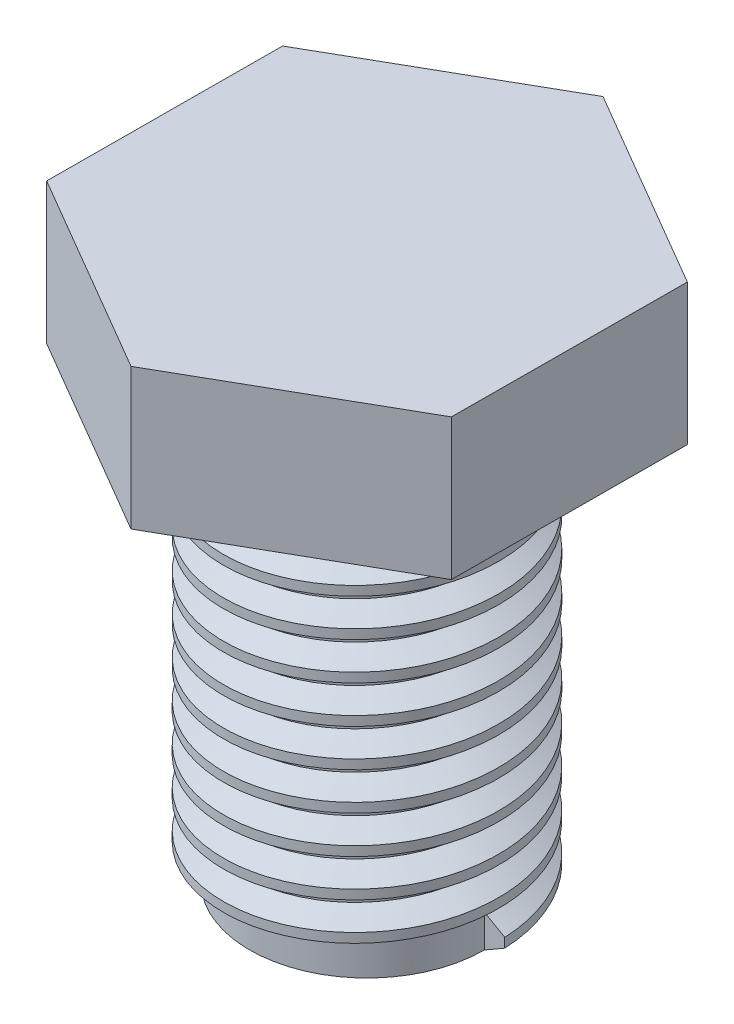
from build123d import *
from build123d.topology import SkipClean

# Parameters (mm, degrees)
SKETCH1_R           = 12.5
BOSS_EXTRUDE1_DEPTH = 45
BOSS_EXTRUDE2_DEPTH = 15
THREAD1_PITCH       = 4


with BuildPart() as part:
    # Sketch1 → Boss-Extrude1 (new body)
    with BuildSketch(Plane(origin=(0, 0, 0), x_dir=(1, 0, 0), z_dir=(0, 1, 0))):
        with Locations(Location((0, 0, 0), (0, 0, 90))):
            Circle(SKETCH1_R)
    extrude(amount=BOSS_EXTRUDE1_DEPTH)

    # Sketch2 → Boss-Extrude2 (add)
    with BuildSketch(Plane(origin=(0, 45, 0), x_dir=(1, 0, 0), z_dir=(0, 1, 0))):
        Polygon((21.588652496, -12.606747535), (21.712089872, 12.392947727), (0.123437376, 24.999695262), (-21.588652496, 12.606747535), (-21.712089872, -12.392947727), (-0.123437376, -24.999695262), align=None)
    extrude(amount=BOSS_EXTRUDE2_DEPTH)

    # Thread1: the profile of Thread Profile1 profile screwed along a right-hand helix of 11.25 turns, 12 arcs to a turn; built about Z, then put on its axis
    with SkipClean():  # the faces are left unmerged after this step: merging them gives an invalid solid
        thread1_z = Axis((0, 0, 0), (0, 0, 1))
        thread1_corners = [(12.4997, 0, -0.000173205), (12.4997, 0, 3.500173194), (14.6650635, 0, 2.249999995), (14.6650635, 0, 1.249999995)]
        with BuildLine(mode=Mode.PRIVATE) as thread1_profile:
            Line(thread1_corners[0], thread1_corners[1])
            Line(thread1_corners[1], thread1_corners[2])
            Line(thread1_corners[2], thread1_corners[3])
            Line(thread1_corners[3], thread1_corners[0])
        thread1_cap = Face(thread1_profile.wire())
        thread1_turn_angles = [0, 15, 30, 45, 60, 75, 90, 105, 120, 135, 150, 165, 180, 195, 210, 225, 240, 255, 270, 285, 300, 315, 330, 345, 360]
        thread1_turn_weights = [1, 0.9659258262890683, 1, 0.9659258262890683, 1, 0.9659258262890683, 1, 0.9659258262890683, 1, 0.9659258262890683, 1, 0.9659258262890683, 1, 0.9659258262890683, 1, 0.9659258262890683, 1, 0.9659258262890683, 1, 0.9659258262890683, 1, 0.9659258262890683, 1, 0.9659258262890683, 1]
        thread1_turn_rails = [Edge.make_bspline([Vector(p[0], p[1], 0).rotate(thread1_z, thread1_turn_angles[k]) / thread1_turn_weights[k] + Vector(0, 0, p[2] + THREAD1_PITCH * thread1_turn_angles[k] / 360) for k in range(25)], [0, 0, 0, 1, 1, 2, 2, 3, 3, 4, 4, 5, 5, 6, 6, 7, 7, 8, 8, 9, 9, 10, 10, 11, 11, 12, 12, 12], 2, thread1_turn_weights) for p in thread1_corners]
        thread1_turn_sides = [Face.make_surface_from_curves(thread1_turn_rails[p[0]], thread1_turn_rails[p[1]]) for p in [(0, 1), (1, 2), (2, 3), (3, 0)]]
        thread1_last_angles = [3960, 3975, 3990, 4005, 4020, 4035, 4050]
        thread1_last_weights = [1, 0.9659258262890683, 1, 0.9659258262890683, 1, 0.9659258262890683, 1]
        thread1_last_rails = [Edge.make_bspline([Vector(p[0], p[1], 0).rotate(thread1_z, thread1_last_angles[k]) / thread1_last_weights[k] + Vector(0, 0, p[2] + THREAD1_PITCH * thread1_last_angles[k] / 360) for k in range(7)], [0, 0, 0, 1, 1, 2, 2, 3, 3, 3], 2, thread1_last_weights) for p in thread1_corners]
        thread1_last_sides = [Face.make_surface_from_curves(thread1_last_rails[p[0]], thread1_last_rails[p[1]]) for p in [(0, 1), (1, 2), (2, 3), (3, 0)]]
        thread1 = Plane(origin=(0, 0, 0), x_dir=(1, 0, 0), z_dir=(0, 1, 0)) * Solid(Shell([*[p.moved(Location((0, 0, THREAD1_PITCH * i))) for i in range(11) for p in thread1_turn_sides], *thread1_last_sides, thread1_cap, thread1_cap.rotate(thread1_z, 4050).moved(Location((0, 0, THREAD1_PITCH * 4050 / 360)))]))
        add(thread1)


solid = part.part
